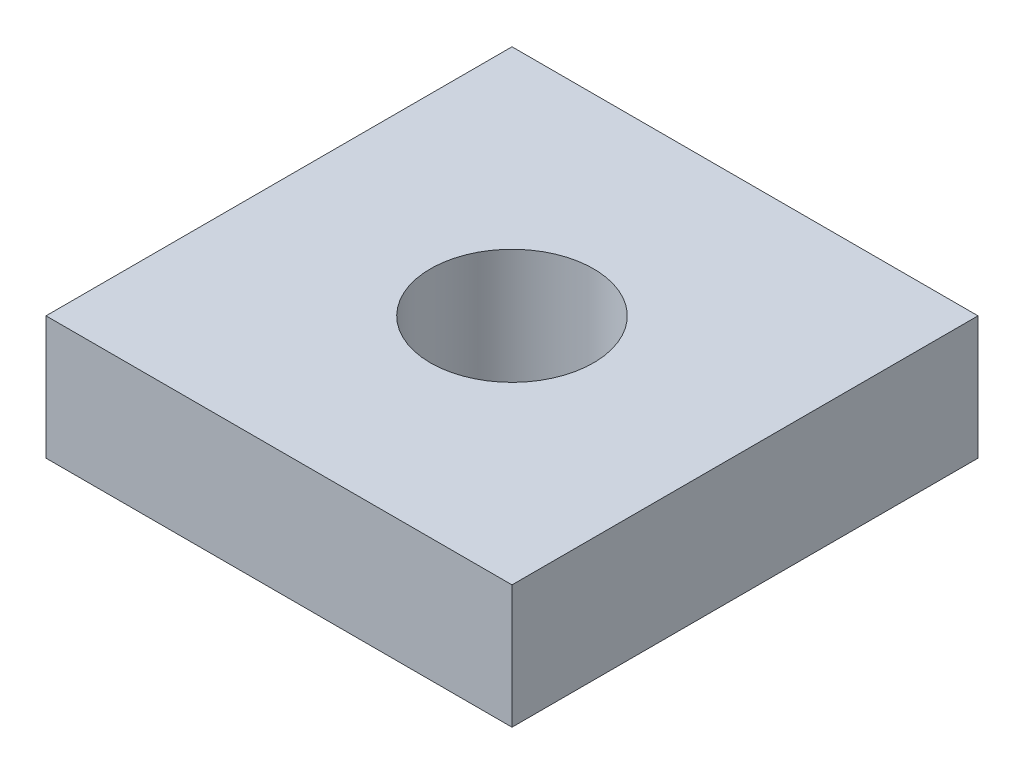
from build123d import *

# Parameters (mm, degrees)
SKETCH2_W           = 12
SKETCH2_H           = 12
SKETCH2_R           = 2.1
BOSS_EXTRUDE1_DEPTH = 3.175


with BuildPart() as part:
    # Sketch2 → Boss-Extrude1 (new body)
    with BuildSketch(Plane(origin=(0, 0, 0), x_dir=(1, 0, 0), z_dir=(0, 1, 0))):
        with Locations((-6, 6)):
            Rectangle(SKETCH2_W, SKETCH2_H)
        with Locations((-6, 6)):
            Circle(SKETCH2_R, mode=Mode.SUBTRACT)
    extrude(amount=BOSS_EXTRUDE1_DEPTH)


solid = part.part
